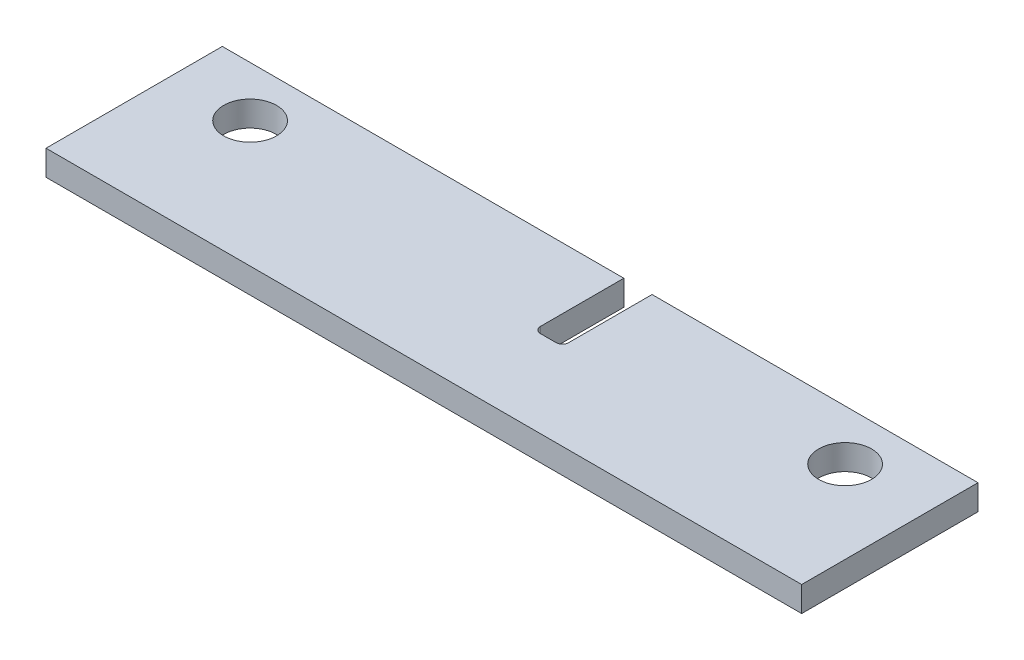
from build123d import *

# Parameters (mm, degrees)
BOSS_EXTRUDE1_DEPTH      = 50.8
BOSS_EXTRUDE1_DEPTH_BACK = 38.1
SKETCH2_W                = 381
SKETCH2_H                = 12.7
SKETCH3_W                = 12.7
SKETCH3_H                = 44.45
CUT_EXTRUDE1_DEPTH       = 2664.230012597
CAVITY1_START            = 115.8
CAVITY1_OUTLINE_R        = 12.7
CAVITY1_DEPTH            = 12.7
MOVE_FACE_HOLES_BY       = 0.635
MOVE_FACE_HOLES_2_BY     = 0.635
MOVE_FACE_SLOTS_BY       = 0.762
MOVE_FACE_SLOTS_2_BY     = 0.762
MOVE_FACE_SLOTS_3_BY     = 0.762
SLOT_FILLET_R            = 3.175


# Read off the part's stored shape, not the designer's step: Cavity1
with BuildPart() as part:
    # Sketch2 → Boss-Extrude1 (new, two sides: drawn at the far end of the back side and taken through both)
    with BuildSketch(Plane.XY.offset(287.7).offset(-BOSS_EXTRUDE1_DEPTH_BACK)):
        with Locations((2451.1, 122.15)):
            Rectangle(SKETCH2_W, SKETCH2_H)
    extrude(amount=BOSS_EXTRUDE1_DEPTH + BOSS_EXTRUDE1_DEPTH_BACK)

    # Sketch3 → Cut-Extrude1 (cut, through all)
    with BuildSketch(Plane(origin=(0, 128.5, 0), x_dir=(1, 0, 0), z_dir=(0, 1, 0))):
        with Locations((2470.15, -271.825)):
            Rectangle(SKETCH3_W, SKETCH3_H)
    extrude(amount=-CUT_EXTRUDE1_DEPTH, mode=Mode.SUBTRACT)

    # Cavity1 outline → Cavity1 (cut)
    with BuildSketch(Plane(origin=(0, 0, 0), x_dir=(1, 0, 0), z_dir=(0, 1, 0)).offset(CAVITY1_START)):
        with Locations((2300, -275)):
            Circle(CAVITY1_OUTLINE_R)
        with Locations((2600, -275)):
            Circle(CAVITY1_OUTLINE_R)
    extrude(amount=CAVITY1_DEPTH, mode=Mode.SUBTRACT)

    # Move Face Holes: a curved face moved inward by 0.635
    add(Solid.thicken(part.faces().sort_by_distance((2587.3, 122.15, 275))[0], -MOVE_FACE_HOLES_BY), mode=Mode.SUBTRACT)

    # Move Face Holes 2: a curved face moved inward by 0.635
    add(Solid.thicken(part.faces().sort_by_distance((2287.3, 122.15, 275))[0], -MOVE_FACE_HOLES_2_BY), mode=Mode.SUBTRACT)

    # Move Face Slots: a face moved inward by 0.762
    extrude(part.faces().sort_by_distance((2463.8, 122.15, 271.825))[0], amount=MOVE_FACE_SLOTS_BY, dir=(-1, 0, 0), mode=Mode.SUBTRACT)

    # Move Face Slots 2: a face moved inward by 0.762
    extrude(part.faces().sort_by_distance((2470.15, 122.15, 294.05))[0], amount=MOVE_FACE_SLOTS_2_BY, dir=(0, 0, 1), mode=Mode.SUBTRACT)

    # Move Face Slots 3: a face moved inward by 0.762
    extrude(part.faces().sort_by_distance((2476.5, 122.15, 271.825))[0], amount=MOVE_FACE_SLOTS_3_BY, dir=(1, 0, 0), mode=Mode.SUBTRACT)

    # Slot Fillet
    slot_fillet_edges = [part.edges().sort_by_distance(p)[0] for p in [
        (2477.262, 122.15, 294.812),
        (2463.038, 122.15, 294.812),
    ]]
    fillet(slot_fillet_edges, radius=SLOT_FILLET_R)


solid = part.part
